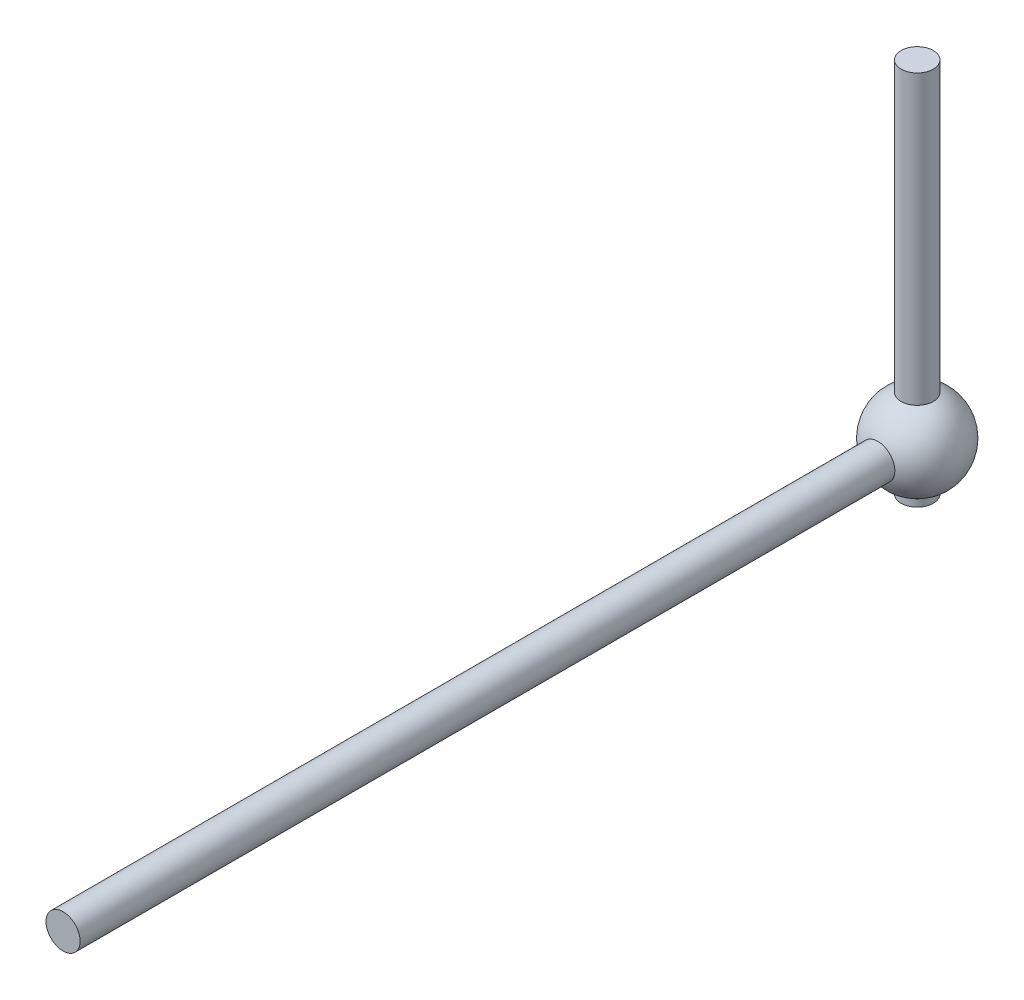
from build123d import *

# Parameters (mm, degrees)
SKETCH1_R           = 3.175
BOSS_EXTRUDE1_DEPTH = 159
REVOLVE1_ANGLE      = 359.999695921


with BuildPart() as part:
    # Sketch1 → Boss-Extrude1 (new body)
    with BuildSketch(Plane.XY):
        Circle(SKETCH1_R)
    extrude(amount=BOSS_EXTRUDE1_DEPTH)

    # Sketch2 → Revolve1 (revolve)
    with BuildSketch(Plane.XY):
        with BuildLine():
            Line((0, -9), (3, -9))
            Line((3, -9), (3, -7.416198487))
            ThreePointArc((3, -7.416198487), (8, 0), (3, 7.416198487))
            Line((3, 7.416198487), (3, 61))
            Line((3, 61), (0, 61))
            Line((0, 61), (0, -9))
        make_face()
    revolve(axis=Axis((0, -9, 0), (0, 1, 0)), revolution_arc=REVOLVE1_ANGLE)


solid = part.part
